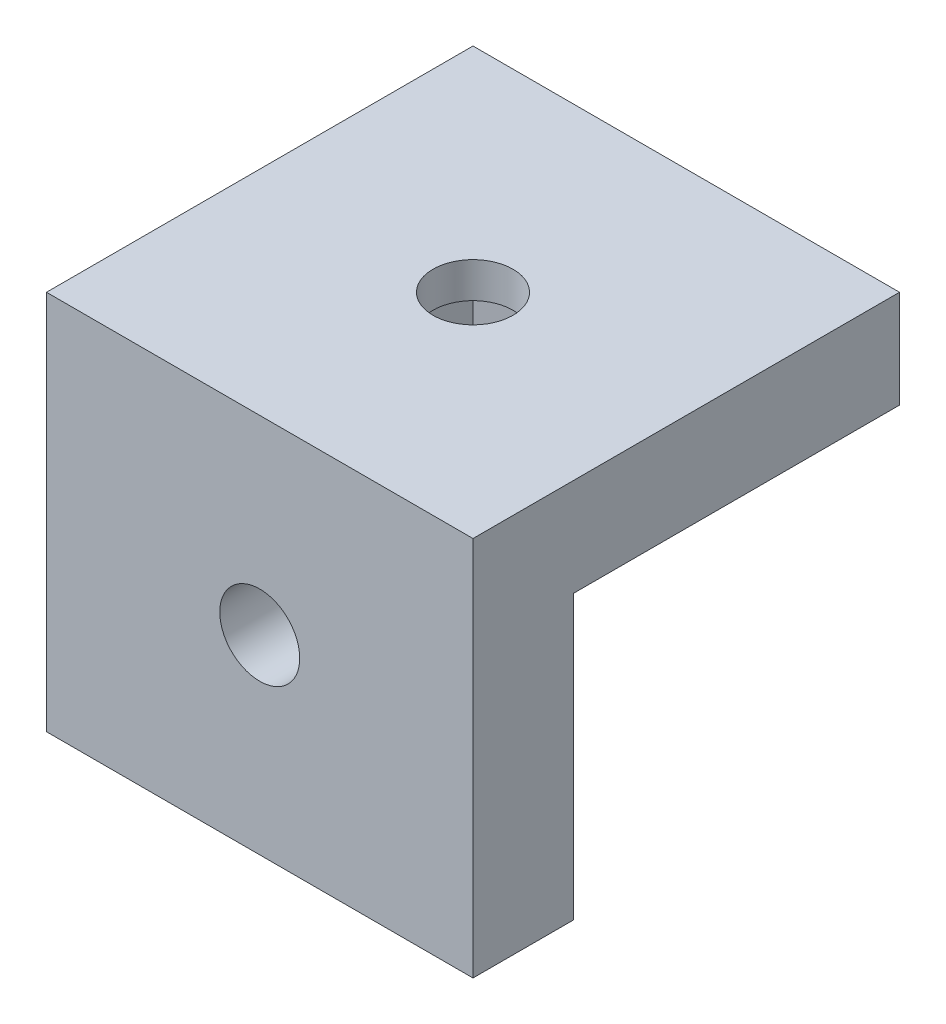
from build123d import *

# Parameters (mm, degrees)
SKETCH1_W                    = 38.1
SKETCH1_H                    = 38.1
MAIN_BODY_DEPTH              = 34
F_9_32_RIGHT_RAIL_DEPTH      = 64.712008287
F_9_32_RIGHT_RAIL_DEPTH_BACK = 5.55625
SKETCH3_R                    = 3.571875
SKETCH4_R                    = 3.571875
F_9_32_LEFT_RAIL_DEPTH       = 5.55625
F_9_32_TOPPER_DEPTH          = 64.712008287
F_9_32_TOPPER_DEPTH_BACK     = 10
SKETCH8_R                    = 3.571875
CUT_EXTRUDE3_START           = -5.55625
CUT_EXTRUDE3_DEPTH           = 32.54375
CUT_EXTRUDE4_START           = -5.55625
CUT_EXTRUDE4_DEPTH           = 32.54375
CUT_EXTRUDE12_START          = -30.825
CUT_EXTRUDE12_OUTLINE_W      = 29.119345377
CUT_EXTRUDE12_OUTLINE_H      = 29.119345377
CUT_EXTRUDE12_DEPTH          = 22.09375
CUT_EXTRUDE15_START          = -17
CUT_EXTRUDE15_DEPTH          = 13.825
CUT_EXTRUDE16_REACH          = 65.712


# Read off the part's stored shape, not the designer's step: Cut-Extrude12
with BuildPart() as part:
    # Sketch1 → Main Body (new body)
    with BuildSketch(Plane(origin=(0, 0, 0), x_dir=(1, 0, 0), z_dir=(0, 1, 0))):
        with Locations((19.05, 19.05)):
            Rectangle(SKETCH1_W, SKETCH1_H)
    extrude(amount=MAIN_BODY_DEPTH)

    # Sketch3 → 9/32 Right Rail (cut, two sides: drawn at the far end of the back side and taken through both)
    with BuildSketch(Plane.XY.offset(-F_9_32_RIGHT_RAIL_DEPTH_BACK)):
        with Locations(Location((19.05, 17, 0), (0, 0, 180))):
            Circle(SKETCH3_R)
    extrude(amount=F_9_32_RIGHT_RAIL_DEPTH + F_9_32_RIGHT_RAIL_DEPTH_BACK, mode=Mode.SUBTRACT)

    # Sketch4 → 9/32 Left Rail (cut)
    with BuildSketch(Plane.ZY):
        with Locations((-19.05, 17)):
            Circle(SKETCH4_R)
    extrude(amount=-F_9_32_LEFT_RAIL_DEPTH, mode=Mode.SUBTRACT)

    # Sketch8 → 9/32 Topper (cut, two sides: drawn at the far end of the back side and taken through both)
    with BuildSketch(Plane(origin=(0, 34, 0), x_dir=(1, 0, 0), z_dir=(0, 1, 0)).offset(-F_9_32_TOPPER_DEPTH_BACK)):
        with Locations(Location((19.05, 19.05, 0), (0, 0, 90))):
            Circle(SKETCH8_R)
    extrude(amount=F_9_32_TOPPER_DEPTH + F_9_32_TOPPER_DEPTH_BACK, mode=Mode.SUBTRACT)

    # Sketch9 → Cut-Extrude3 (cut)
    with BuildSketch(Plane.ZY.offset(CUT_EXTRUDE3_START)):
        Polygon((-22.372470377, 22.7546875), (-25.694940754, 17), (-22.372470377, 11.2453125), (-15.727529623, 11.2453125), (-12.405059246, 17), (-15.727529623, 22.7546875), align=None)
    extrude(amount=-CUT_EXTRUDE3_DEPTH, mode=Mode.SUBTRACT)

    # Sketch10 → Cut-Extrude4 (cut)
    with BuildSketch(Plane.XY.offset(CUT_EXTRUDE4_START)):
        Polygon((15.727529623, 22.7546875), (12.405059246, 17), (15.727529623, 11.2453125), (22.372470377, 11.2453125), (25.694940754, 17), (22.372470377, 22.7546875), align=None)
    extrude(amount=-CUT_EXTRUDE4_DEPTH, mode=Mode.SUBTRACT)

    # Cut-Extrude12 outline → Cut-Extrude12 (cut)
    with BuildSketch(Plane(origin=(0, 34, 0), x_dir=(1, 0, 0), z_dir=(0, 1, 0)).offset(CUT_EXTRUDE12_START)):
        with Locations((23.540327312, 23.540327312)):
            Rectangle(CUT_EXTRUDE12_OUTLINE_W, CUT_EXTRUDE12_OUTLINE_H)
    extrude(amount=CUT_EXTRUDE12_DEPTH, mode=Mode.SUBTRACT)

    # Sketch14 → Cut-Extrude15 (cut)
    with BuildSketch(Plane(origin=(0, 34, 0), x_dir=(1, 0, 0), z_dir=(0, 1, 0)).offset(CUT_EXTRUDE15_START)):
        Polygon((23.748682668, 14.351317332), (25.468519889, 20.769837221), (20.769837221, 25.468519889), (14.351317332, 23.748682668), (12.631480111, 17.330162779), (17.330162779, 12.631480111), align=None)
    extrude(amount=CUT_EXTRUDE15_DEPTH, mode=Mode.SUBTRACT)

    # Sketch15 → Cut-Extrude16 (cut, up to next)
    with BuildSketch(Plane.XZ, mode=Mode.PRIVATE) as cut_extrude16_sk1:
        Polygon((38.1, -8.980654623), (8.980654623, -38.1), (38.1, -38.1), align=None)
    cut_extrude16_tool1 = extrude(cut_extrude16_sk1.sketch, amount=-CUT_EXTRUDE16_REACH, mode=Mode.PRIVATE) & part.part
    add(cut_extrude16_tool1.solids().sort_by_distance((28.393552, 0, -28.393552))[0], mode=Mode.SUBTRACT)


solid = part.part
